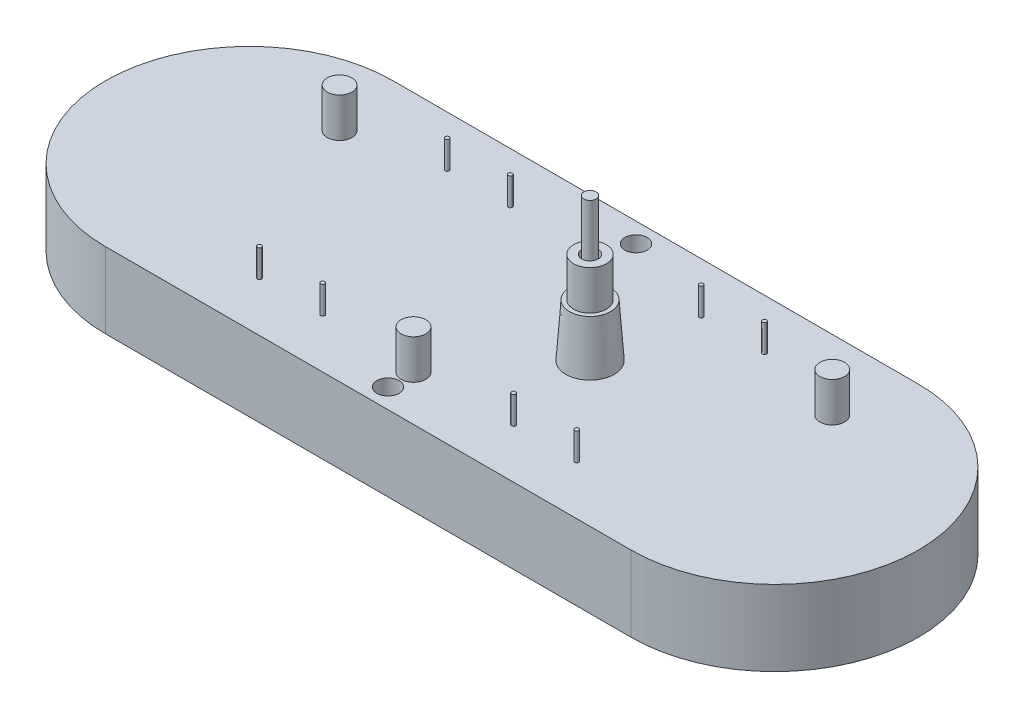
from build123d import *

# Parameters (mm, degrees)
BOSS_EXTRUDE1_DEPTH = 9.2
SKETCH2_W           = 0.75
SKETCH2_H           = 17.4
SKETCH3_R           = 1.5
BOSS_EXTRUDE2_DEPTH = 4.8
SKETCH4_R           = 0.25
BOSS_EXTRUDE3_DEPTH = 3.35
SKETCH5_R           = 1.35
CUT_EXTRUDE1_DEPTH  = 56.31057765


with BuildPart() as part:
    # Sketch1 → Boss-Extrude1 (new body)
    with BuildSketch(Plane(origin=(0, 0, 0), x_dir=(1, 0, 0), z_dir=(0, 1, 0))):
        with BuildLine():
            Line((-32, 17.5), (32, 17.5))
            ThreePointArc((32, 17.5), (49.5, 0), (32, -17.5))
            Line((32, -17.5), (-32, -17.5))
            ThreePointArc((-32, -17.5), (-49.5, 0), (-32, 17.5))
        make_face()
    extrude(amount=-BOSS_EXTRUDE1_DEPTH)

    # Sketch2 → Revolve1 (revolve)
    with BuildSketch(Plane(origin=(9.5, 0, 0), x_dir=(0, 0, -1), z_dir=(1, 0, 0))):
        with Locations((0.375, 8.7)):
            Rectangle(SKETCH2_W, SKETCH2_H)
        Polygon((1, 0), (2.947531596, 0), (2.5, 6.4), (2, 6.4), (2, 11.2), (1, 11.2), align=None)
    revolve(axis=Axis((9.5, 0, 0), (0, 1, 0)))

    # Sketch3 → Boss-Extrude2 (add)
    with BuildSketch(Plane(origin=(0, 0, 0), x_dir=(1, 0, 0), z_dir=(0, 1, 0))):
        with Locations((0, -12)):
            Circle(SKETCH3_R)
        with Locations((30, 9)):
            Circle(SKETCH3_R)
        with Locations((-30, 9)):
            Circle(SKETCH3_R)
    extrude(amount=BOSS_EXTRUDE2_DEPTH)

    # Sketch4 → Boss-Extrude3 (add)
    with BuildSketch(Plane(origin=(0, 0, 0), x_dir=(1, 0, 0), z_dir=(0, 1, 0))):
        with Locations((-19.32, 11.425)):
            Circle(SKETCH4_R)
        with Locations((-11.62, 11.425)):
            Circle(SKETCH4_R)
        with Locations((-11.62, -11.425)):
            Circle(SKETCH4_R)
        with Locations((-19.32, -11.425)):
            Circle(SKETCH4_R)
        with Locations((19.32, -11.425)):
            Circle(SKETCH4_R)
        with Locations((11.62, -11.425)):
            Circle(SKETCH4_R)
        with Locations((11.62, 11.425)):
            Circle(SKETCH4_R)
        with Locations((19.32, 11.425)):
            Circle(SKETCH4_R)
    extrude(amount=BOSS_EXTRUDE3_DEPTH)

    # Sketch5 → Cut-Extrude1 (cut, through all)
    with BuildSketch(Plane(origin=(0, 0, 0), x_dir=(1, 0, 0), z_dir=(0, 1, 0))):
        with Locations((0, 15.1)):
            Circle(SKETCH5_R)
        with Locations((0, -15.1)):
            Circle(SKETCH5_R)
    extrude(amount=-CUT_EXTRUDE1_DEPTH, mode=Mode.SUBTRACT)


solid = part.part
